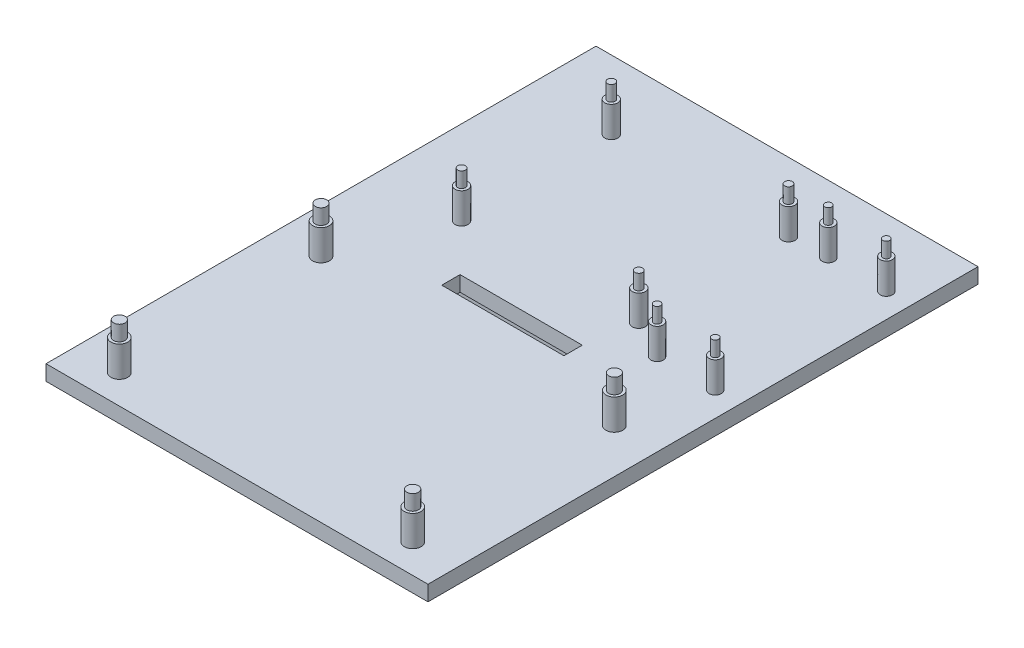
from build123d import *

# Parameters (mm, degrees)
ESQUISSE1_W             = 62
ESQUISSE1_H             = 12
ESQUISSE1_W_2           = 58
ESQUISSE1_H_2           = 8
BOSS_EXTRU_1_DEPTH      = 15
ESQUISSE2_R             = 3.175
ENL_V_MAT_EXTRU_1_DEPTH = 37.469165058
ESQUISSE3_W             = 125
ESQUISSE3_H             = 180
BOSS_EXTRU_2_DEPTH      = 5
ENL_V_MAT_EXTRU_3_REACH = 112.595
ESQUISSE6_W             = 40
ESQUISSE6_H             = 6
ESQUISSE11_R            = 2.75
BOSS_EXTRU_3_DEPTH      = 10
ESQUISSE13_R            = 2
BOSS_EXTRU_4_DEPTH      = 10
ESQUISSE12_R            = 2.125
BOSS_EXTRU_5_DEPTH      = 10
ESQUISSE10_R            = 1.875
BOSS_EXTRU_6_DEPTH      = 15
ESQUISSE9_R             = 1.125
BOSS_EXTRU_7_DEPTH      = 15
ESQUISSE8_R             = 1.25
BOSS_EXTRU_8_DEPTH      = 15


with BuildPart() as part:
    # Esquisse1 → Boss.-Extru.1 (new body)
    with BuildSketch(Plane(origin=(0, 0, 0), x_dir=(1, 0, 0), z_dir=(0, 1, 0))):
        Rectangle(ESQUISSE1_W, ESQUISSE1_H)
        Rectangle(ESQUISSE1_W_2, ESQUISSE1_H_2, mode=Mode.SUBTRACT)
    extrude(amount=BOSS_EXTRU_1_DEPTH)

    # Esquisse2 → Enlèv. mat.-Extru.1 (cut, through all)
    with BuildSketch(Plane.XY.offset(6)):
        with Locations((0, 9)):
            Circle(ESQUISSE2_R)
    extrude(amount=-ENL_V_MAT_EXTRU_1_DEPTH, mode=Mode.SUBTRACT)

    # Esquisse3 → Boss.-Extru.2 (add)
    with BuildSketch(Plane(origin=(0, 15, 0), x_dir=(1, 0, 0), z_dir=(0, 1, 0))):
        Rectangle(ESQUISSE3_W, ESQUISSE3_H)
    extrude(amount=BOSS_EXTRU_2_DEPTH)

    # Esquisse6 → Enlèv. mat.-Extru.3 (cut, up to next)
    with BuildSketch(Plane(origin=(0, 15, 0), x_dir=(-1, 0, 0), z_dir=(0, -1, 0)), mode=Mode.PRIVATE) as enl_v_mat_extru_3_sk1:
        Rectangle(ESQUISSE6_W, ESQUISSE6_H)
    enl_v_mat_extru_3_tool1 = extrude(enl_v_mat_extru_3_sk1.sketch, amount=-ENL_V_MAT_EXTRU_3_REACH, mode=Mode.PRIVATE) & part.part
    add(enl_v_mat_extru_3_tool1.solids().sort_by_distance((0, 15, 0))[0], mode=Mode.SUBTRACT)

    # Esquisse11 → Boss.-Extru.3 (add)
    with BuildSketch(Plane(origin=(0, 20, 0), x_dir=(1, 0, 0), z_dir=(0, 1, 0))):
        with Locations((-48, -14.5)):
            Circle(ESQUISSE11_R)
        with Locations((-48, -80.5)):
            Circle(ESQUISSE11_R)
        with Locations((48, -14.5)):
            Circle(ESQUISSE11_R)
        with Locations((48, -80.5)):
            Circle(ESQUISSE11_R)
    extrude(amount=BOSS_EXTRU_3_DEPTH)

    # Esquisse13 → Boss.-Extru.4 (add)
    with BuildSketch(Plane(origin=(0, 20, 0), x_dir=(1, 0, 0), z_dir=(0, 1, 0))):
        with Locations((54.5, 12)):
            Circle(ESQUISSE13_R)
        with Locations((54.5, 68)):
            Circle(ESQUISSE13_R)
        with Locations((35.5, 12)):
            Circle(ESQUISSE13_R)
        with Locations((35.5, 68)):
            Circle(ESQUISSE13_R)
    extrude(amount=BOSS_EXTRU_4_DEPTH)

    # Esquisse12 → Boss.-Extru.5 (add)
    with BuildSketch(Plane(origin=(0, 20, 0), x_dir=(1, 0, 0), z_dir=(0, 1, 0))):
        with Locations((23, 67.5)):
            Circle(ESQUISSE12_R)
        with Locations((23, 18.5)):
            Circle(ESQUISSE12_R)
        with Locations((-35, 67.5)):
            Circle(ESQUISSE12_R)
        with Locations((-35, 18.5)):
            Circle(ESQUISSE12_R)
    extrude(amount=BOSS_EXTRU_5_DEPTH)

    # Esquisse10 → Boss.-Extru.6 (add)
    with BuildSketch(Plane(origin=(0, 20, 0), x_dir=(1, 0, 0), z_dir=(0, 1, 0))):
        with Locations((-48, -14.5)):
            Circle(ESQUISSE10_R)
        with Locations((48, -14.5)):
            Circle(ESQUISSE10_R)
        with Locations((-48, -80.5)):
            Circle(ESQUISSE10_R)
        with Locations((48, -80.5)):
            Circle(ESQUISSE10_R)
    extrude(amount=BOSS_EXTRU_6_DEPTH)

    # Esquisse9 → Boss.-Extru.7 (add)
    with BuildSketch(Plane(origin=(0, 20, 0), x_dir=(1, 0, 0), z_dir=(0, 1, 0))):
        with Locations((54.5, 68)):
            Circle(ESQUISSE9_R)
        with Locations((35.5, 68)):
            Circle(ESQUISSE9_R)
        with Locations((54.5, 12)):
            Circle(ESQUISSE9_R)
        with Locations((35.5, 12)):
            Circle(ESQUISSE9_R)
    extrude(amount=BOSS_EXTRU_7_DEPTH)

    # Esquisse8 → Boss.-Extru.8 (add)
    with BuildSketch(Plane(origin=(0, 20, 0), x_dir=(1, 0, 0), z_dir=(0, 1, 0))):
        with Locations((23, 67.5)):
            Circle(ESQUISSE8_R)
        with Locations((23, 18.5)):
            Circle(ESQUISSE8_R)
        with Locations((-35, 67.5)):
            Circle(ESQUISSE8_R)
        with Locations((-35, 18.5)):
            Circle(ESQUISSE8_R)
    extrude(amount=BOSS_EXTRU_8_DEPTH)


solid = part.part
